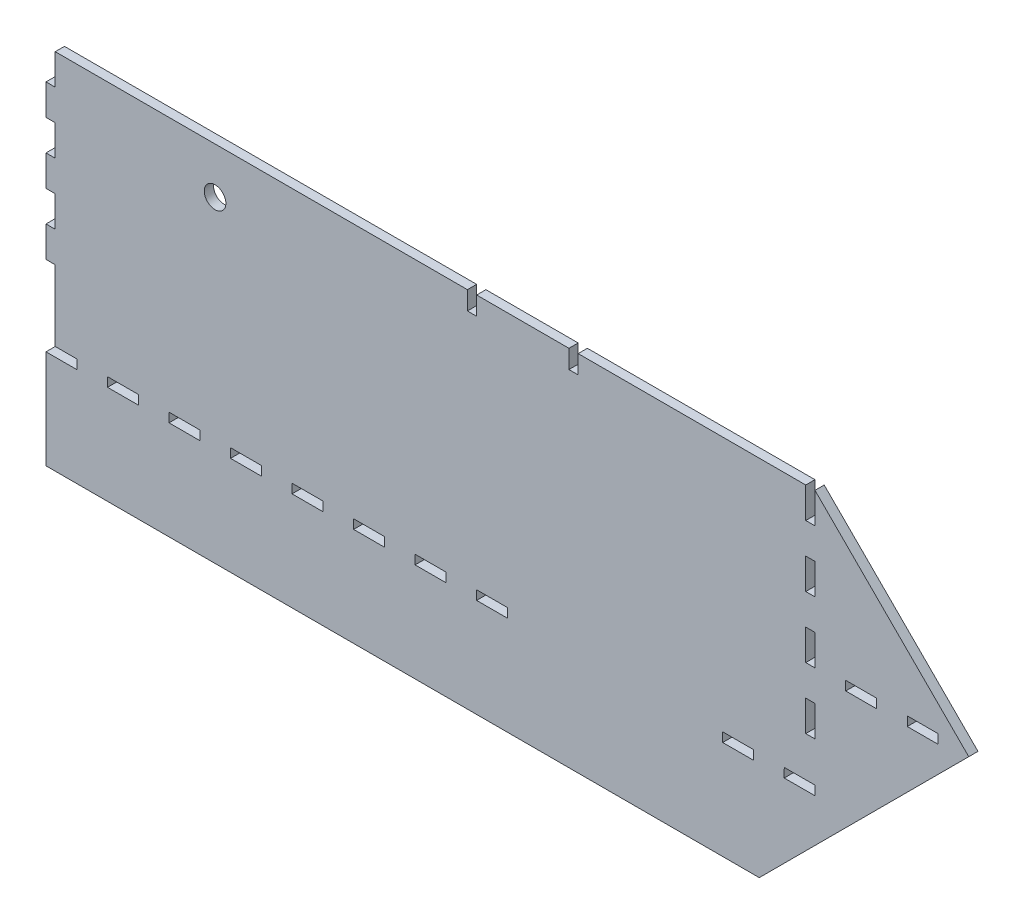
from build123d import *

# Parameters (mm, degrees)
SKETCH1_W           = 10
SKETCH1_H           = 3
SKETCH1_W_2         = 3
SKETCH1_H_2         = 10
SKETCH1_R           = 3.51869208
BOSS_EXTRUDE1_DEPTH = 3


with BuildPart() as part:
    # Sketch1 → Boss-Extrude1 (new body)
    with BuildSketch(Plane.XY):
        Polygon((-112.631023813, -53.728350242), (-112.631023813, -63.840272517), (-112.631023813, -85.840272517), (119.257053912, -85.840272517), (137.368976187, -67.728350242), (187.368976187, -17.728350242), (137.368976187, 32.271649758), (137.368976187, 22.271649758), (134.368976187, 22.271649758), (134.368976187, 32.271649758), (60.378976187, 32.271649758), (60.378976187, 26.271649758), (57.378976187, 26.271649758), (57.378976187, 32.271649758), (42.378976187, 32.271649758), (27.378976187, 32.271649758), (27.378976187, 26.271649758), (24.378976187, 26.271649758), (24.378976187, 32.271649758), (-62.631023813, 32.271649758), (-109.631023813, 32.271649758), (-109.631023813, 22.271649758), (-112.631023813, 22.271649758), (-112.631023813, 12.271649758), (-109.631023813, 12.271649758), (-109.631023813, 2.271649758), (-112.631023813, 2.271649758), (-112.631023813, -7.728350242), (-109.631023813, -7.728350242), (-109.631023813, -17.728350242), (-112.631023813, -17.728350242), (-112.631023813, -27.728350242), (-109.631023813, -27.728350242), (-109.631023813, -50.728350242), (-102.631023813, -50.728350242), (-102.631023813, -53.728350242), align=None)
        with Locations((-87.631023813, -52.228350242)):
            Rectangle(SKETCH1_W, SKETCH1_H, mode=Mode.SUBTRACT)
        with Locations((-67.631023813, -52.228350242)):
            Rectangle(SKETCH1_W, SKETCH1_H, mode=Mode.SUBTRACT)
        with Locations((-47.631023813, -52.228350242)):
            Rectangle(SKETCH1_W, SKETCH1_H, mode=Mode.SUBTRACT)
        with Locations((-27.631023813, -52.228350242)):
            Rectangle(SKETCH1_W, SKETCH1_H, mode=Mode.SUBTRACT)
        with Locations((-7.631023813, -52.228350242)):
            Rectangle(SKETCH1_W, SKETCH1_H, mode=Mode.SUBTRACT)
        with Locations((12.368976187, -52.228350242)):
            Rectangle(SKETCH1_W, SKETCH1_H, mode=Mode.SUBTRACT)
        Polygon((27.368976187, -50.728350242), (37.371405326, -50.728350242), (37.368976187, -53.728350242), (27.368976187, -53.728350242), align=None, mode=Mode.SUBTRACT)
        Polygon((107.3787447, -50.728350242), (117.381121881, -50.728350242), (117.369073889, -53.728350242), (107.369073889, -53.728350242), align=None, mode=Mode.SUBTRACT)
        Polygon((127.381202522, -50.728350242), (137.381202522, -50.728350242), (137.36915453, -53.728350242), (127.36915453, -53.728350242), align=None, mode=Mode.SUBTRACT)
        with Locations((135.868976187, -32.728350242)):
            Rectangle(SKETCH1_W_2, SKETCH1_H_2, mode=Mode.SUBTRACT)
        with Locations((-57.669534365, 17.271649758)):
            Circle(SKETCH1_R, mode=Mode.SUBTRACT)
        with Locations((135.868976187, -12.728350242)):
            Rectangle(SKETCH1_W_2, SKETCH1_H_2, mode=Mode.SUBTRACT)
        with Locations((152.368976187, -17.728350242)):
            Rectangle(SKETCH1_W, SKETCH1_H, mode=Mode.SUBTRACT)
        with Locations((172.368976187, -17.728350242)):
            Rectangle(SKETCH1_W, SKETCH1_H, mode=Mode.SUBTRACT)
        with Locations((135.868976187, 7.271649758)):
            Rectangle(SKETCH1_W_2, SKETCH1_H_2, mode=Mode.SUBTRACT)
    extrude(amount=BOSS_EXTRUDE1_DEPTH)


solid = part.part
